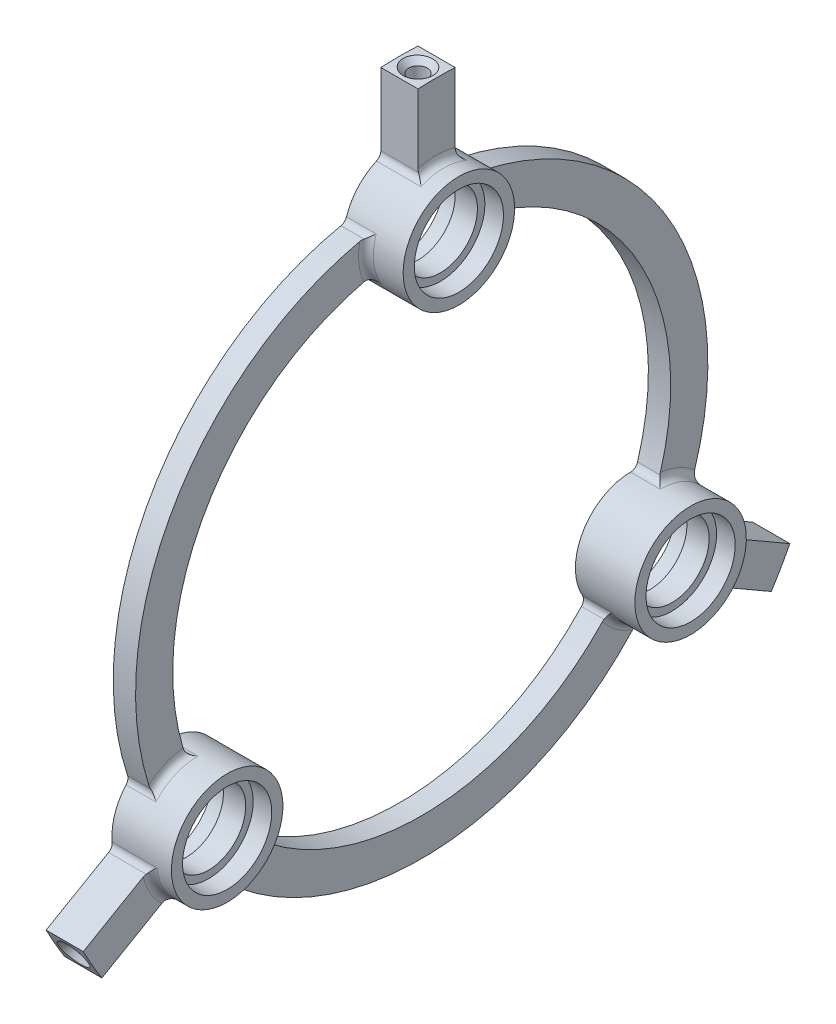
from build123d import *

# Parameters (mm, degrees)
SKETCH_1_R                       = 38.5
SKETCH_1_R_2                     = 33.5
EXTRUDE_1_DEPTH                  = 3
SKETCH_2_R                       = 7.5
EXTRUDE_2_DEPTH                  = 8
SKETCH_4_R                       = 5
CUT_EXTRUDE_1_DEPTH              = 59.638724406
SKETCH_5_R                       = 6
CUT_EXTRUDE_2_DEPTH              = 2.5
CUT_EXTRUDE_START                = -2.5
SKETCH_6_R                       = 6
CUT_EXTRUDE_3_DEPTH              = 2.5
EXTRUDE_3_DEPTH                  = 5
FILLET_1_R                       = 1
PATTERN_CIRCULAR_1_COUNT         = 3
FILLET_1_OF_PATTERN_CIRCULAR_1_R = 1


with BuildPart() as part:
    # Эскиз1 → Бобышка-Вытянуть1 (new body)
    with BuildSketch(Plane(origin=(0, 0, 0), x_dir=(0, 0, -1), z_dir=(1, 0, 0))):
        Circle(SKETCH_1_R)
        Circle(SKETCH_1_R_2, mode=Mode.SUBTRACT)
    extrude(amount=EXTRUDE_1_DEPTH)

    # Эскиз2 → Бобышка-Вытянуть2 (add)
    with BuildSketch(Plane.ZY):
        with Locations((0, 36)):
            Circle(SKETCH_2_R)
    extrude_2 = extrude(amount=-EXTRUDE_2_DEPTH)

    # Эскиз4 → Вырез-Вытянуть1 (cut, through all)
    with BuildSketch(Plane.ZY):
        with Locations((0, 36)):
            Circle(SKETCH_4_R)
    cut_extrude_1 = extrude(amount=-CUT_EXTRUDE_1_DEPTH, mode=Mode.SUBTRACT)

    # Эскиз5 → Вырез-Вытянуть2 (cut)
    with BuildSketch(Plane.ZY):
        with Locations((0, 36)):
            Circle(SKETCH_5_R)
    cut_extrude_2 = extrude(amount=-CUT_EXTRUDE_2_DEPTH, mode=Mode.SUBTRACT)

    # Эскиз6 → Вырез-Вытянуть3 (cut)
    with BuildSketch(Plane(origin=(8, 0, 0), x_dir=(0, 0, -1), z_dir=(1, 0, 0)).offset(CUT_EXTRUDE_START)):
        with Locations((0, 36)):
            Circle(SKETCH_6_R)
    cut_extrude_3 = extrude(amount=CUT_EXTRUDE_3_DEPTH, mode=Mode.SUBTRACT)

    # Эскиз7 → Бобышка-Вытянуть3 (add)
    with BuildSketch(Plane.ZY):
        with BuildLine():
            Line((-2.5, 53.441556864), (-2.5, 43.071067812))
            ThreePointArc((-2.5, 43.071067812), (0, 43.5), (2.5, 43.071067812))
            Line((2.5, 43.071067812), (2.5, 53.441556864))
            ThreePointArc((2.5, 53.441556864), (0, 53.5), (-2.5, 53.441556864))
        make_face()
    extrude_3 = extrude(amount=-EXTRUDE_3_DEPTH)

    # Скругление1
    fillet_1_edges = [part.edges().sort_by_distance(p)[0] for p in [
        (3, 34.363332591, 7.319243116),
        (3, 35.262981133, -7.463699029),
        (1.5, 32.805555556, -6.785685278),
        (1.5, 32.805555556, 6.785685278),
        (1.5, 37.805555556, 7.279420934),
        (1.5, 37.805555556, -7.279420934),
        (5, 43.5, 0),
        (2.5, 43.071067812, 2.5),
        (2.5, 43.071067812, -2.5),
    ]]
    fillet(fillet_1_edges, radius=FILLET_1_R)

    # Эскиз8 → Отверстие обработанное метчиком M31 (revolve, cut)
    with BuildSketch(Plane(origin=(2.5, 53.5, 0), x_dir=(0, 0, 1), z_dir=(1, 0, 0))):
        Polygon((0, 0), (0, 7.751075774), (1.25, 7), (1.25, 0.75), (2, 0), align=None)
    hole_wizard_m31 = revolve(axis=Axis((2.5, 59.85, 0), (0, -1, 0)), mode=Mode.SUBTRACT)

    # Круговой массив1: Бобышка-Вытянуть2, Вырез-Вытянуть1, Вырез-Вытянуть2, Вырез-Вытянуть3, Бобышка-Вытянуть3, Отверстие обработанное метчиком M31 ×3 about axis
    pattern_circular_1_axis = Axis((3, 0, 0), (-1, 0, 0))
    add([extrude_2.rotate(pattern_circular_1_axis, i * 360 / PATTERN_CIRCULAR_1_COUNT) for i in range(1, PATTERN_CIRCULAR_1_COUNT)])
    add([cut_extrude_1.rotate(pattern_circular_1_axis, i * 360 / PATTERN_CIRCULAR_1_COUNT) for i in range(1, PATTERN_CIRCULAR_1_COUNT)], mode=Mode.SUBTRACT)
    add([cut_extrude_2.rotate(pattern_circular_1_axis, i * 360 / PATTERN_CIRCULAR_1_COUNT) for i in range(1, PATTERN_CIRCULAR_1_COUNT)], mode=Mode.SUBTRACT)
    add([cut_extrude_3.rotate(pattern_circular_1_axis, i * 360 / PATTERN_CIRCULAR_1_COUNT) for i in range(1, PATTERN_CIRCULAR_1_COUNT)], mode=Mode.SUBTRACT)
    add([extrude_3.rotate(pattern_circular_1_axis, i * 360 / PATTERN_CIRCULAR_1_COUNT) for i in range(1, PATTERN_CIRCULAR_1_COUNT)])
    add([hole_wizard_m31.rotate(pattern_circular_1_axis, i * 360 / PATTERN_CIRCULAR_1_COUNT) for i in range(1, PATTERN_CIRCULAR_1_COUNT)], mode=Mode.SUBTRACT)

    # Скругление1 of Круговой массив1
    fillet_1_of_pattern_circular_1_edges = [part.edges().sort_by_distance(p)[0] for p in [
        (3, -10.84301582, -33.419140541),
        (3, -24.095243531, -26.80678796),
        (1.5, -22.279353611, -25.017601857),
        (1.5, -10.526201945, -31.803287135),
        (1.5, -12.598614324, -36.380281982),
        (1.5, -25.206941232, -29.100861048),
        (5, -21.75, -37.672105065),
        (2.5, -19.370470396, -38.550638893),
        (2.5, -23.700597415, -36.050638893),
        (3, -23.52031677, 26.099897424),
        (3, -11.167737601, 34.270486988),
        (1.5, -10.526201945, 31.803287135),
        (1.5, -22.279353611, 25.017601857),
        (1.5, -25.206941232, 29.100861048),
        (1.5, -12.598614324, 36.380281982),
        (5, -21.75, 37.672105065),
        (2.5, -23.700597415, 36.050638893),
        (2.5, -19.370470396, 38.550638893),
    ]]
    fillet(fillet_1_of_pattern_circular_1_edges, radius=FILLET_1_OF_PATTERN_CIRCULAR_1_R)


solid = part.part
